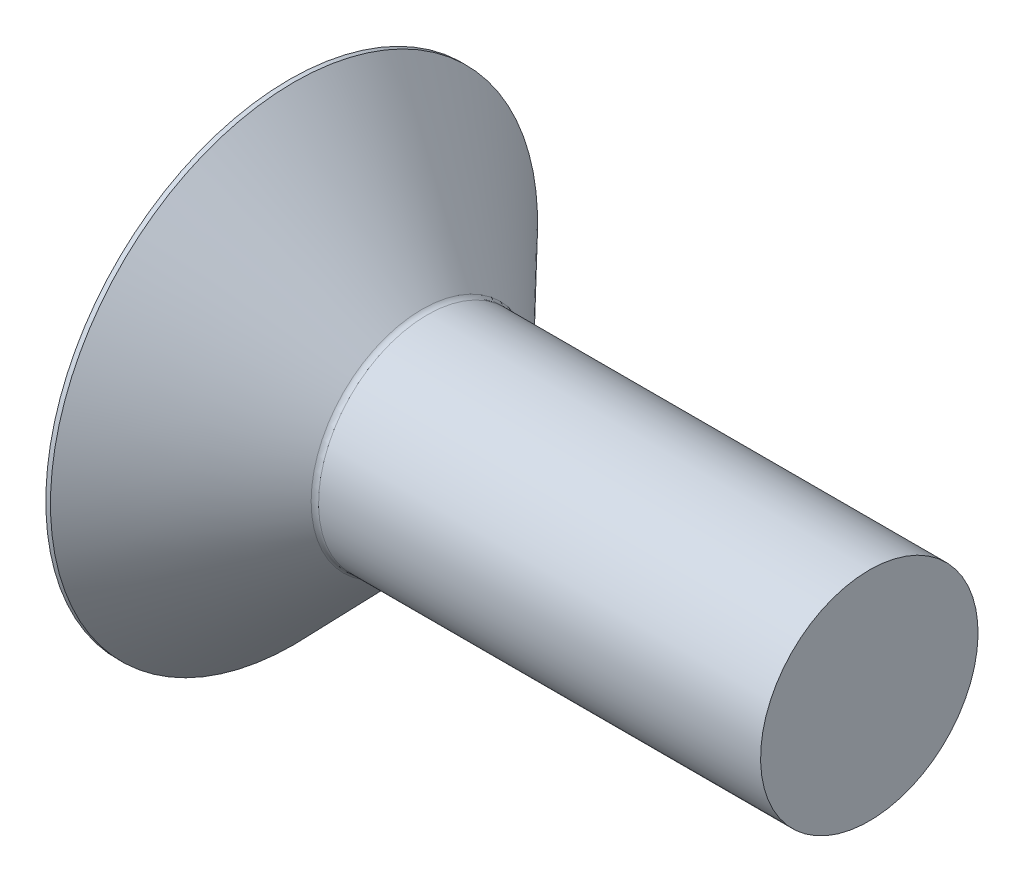
from build123d import *

# Parameters (mm, degrees)
CUT_EXTRUDE_1_DEPTH = 1.2
EXTRUDE_1_REACH     = 10.296


with BuildPart() as part:
    # 草图1 → 旋转1 (revolve)
    with BuildSketch(Plane.XY):
        with BuildLine():
            Line((0, 1.5), (-6.097552518, 1.5))
            ThreePointArc((-6.097552518, 1.5), (-6.136625631, 1.507949515), (-6.169486498, 1.530534163))
            Line((-6.169486498, 1.530534163), (-7.936181121, 3.36))
            Line((-7.936181121, 3.36), (-8, 3.36))
            Line((-8, 3.36), (-8, 0))
            Line((-8, 0), (0, 0))
            Line((0, 0), (0, 1.5))
        make_face()
    revolve(axis=Axis((0, 0, 0), (-1, 0, 0)))

    # 草图2 → 切除-拉伸1 (cut)
    with BuildSketch(Plane.ZY.offset(8)):
        Polygon((0, 1.154700538), (-1, 0.577350269), (-1, -0.577350269), (0, -1.154700538), (1, -0.577350269), (1, 0.577350269), align=None)
    extrude(amount=-CUT_EXTRUDE_1_DEPTH, mode=Mode.SUBTRACT)

    # 切除-拉伸2 cone 1 section (through the dimple's axis) → 切除-拉伸2 (revolve, cut)
    with BuildSketch(Plane(origin=(-6.8, 0, 0), x_dir=(0, 0, 1), z_dir=(0, 1, 0))):
        Polygon((0, 0), (1.154700538, 0), (0, 0.666666667), align=None)
    revolve(axis=Axis((-6.8, 0, 0), (1, 0, 0)), mode=Mode.SUBTRACT)

    # 凸台-拉伸1: up to this cone (the profile starts inside it)
    extrude_1_end = Plane(origin=(-6.8, 0, 0), z_dir=(-1, 0, 0)).offset(-0.666665667) * Cone(1.732e-06, 21.853921057, 12.617366205, align=(Align.CENTER, Align.CENTER, Align.MIN), mode=Mode.PRIVATE)
    # 草图5<3> → 凸台-拉伸1 (add, up to the surface)
    with BuildSketch(Plane.ZY.offset(6.8), mode=Mode.PRIVATE) as extrude_1_sk1:
        with BuildLine():
            ThreePointArc((1, -0.577350269), (1.154700538, 0), (1, 0.577350269))
            Line((1, 0.577350269), (1, -0.577350269))
        make_face()
    extrude_1_tool1 = extrude(extrude_1_sk1.sketch, amount=-EXTRUDE_1_REACH, mode=Mode.PRIVATE) & extrude_1_end
    add(extrude_1_tool1.solids().sort_by_distance((-6.8, 0, 1.06225))[0])
    # 草图5<3> → 凸台-拉伸1 (add, up to the surface)
    with BuildSketch(Plane.ZY.offset(6.8), mode=Mode.PRIVATE) as extrude_1_sk2:
        with BuildLine():
            Line((0, 1.154700538), (1, 0.577350269))
            ThreePointArc((1, 0.577350269), (0.577350269, 1), (0, 1.154700538))
        make_face()
    extrude_1_tool2 = extrude(extrude_1_sk2.sketch, amount=-EXTRUDE_1_REACH, mode=Mode.PRIVATE) & extrude_1_end
    add(extrude_1_tool2.solids().sort_by_distance((-6.8, 0.919935, 0.531125))[0])
    # 草图5<3> → 凸台-拉伸1 (add, up to the surface)
    with BuildSketch(Plane.ZY.offset(6.8), mode=Mode.PRIVATE) as extrude_1_sk3:
        with BuildLine():
            Line((-1, 0.577350269), (0, 1.154700538))
            ThreePointArc((0, 1.154700538), (-0.577350269, 1), (-1, 0.577350269))
        make_face()
    extrude_1_tool3 = extrude(extrude_1_sk3.sketch, amount=-EXTRUDE_1_REACH, mode=Mode.PRIVATE) & extrude_1_end
    add(extrude_1_tool3.solids().sort_by_distance((-6.8, 0.919935, -0.531125))[0])
    # 草图5<3> → 凸台-拉伸1 (add, up to the surface)
    with BuildSketch(Plane.ZY.offset(6.8), mode=Mode.PRIVATE) as extrude_1_sk4:
        with BuildLine():
            ThreePointArc((0, -1.154700538), (0.577350269, -1), (1, -0.577350269))
            Line((1, -0.577350269), (0, -1.154700538))
        make_face()
    extrude_1_tool4 = extrude(extrude_1_sk4.sketch, amount=-EXTRUDE_1_REACH, mode=Mode.PRIVATE) & extrude_1_end
    add(extrude_1_tool4.solids().sort_by_distance((-6.8, -0.919935, 0.531125))[0])
    # 草图5<3> → 凸台-拉伸1 (add, up to the surface)
    with BuildSketch(Plane.ZY.offset(6.8), mode=Mode.PRIVATE) as extrude_1_sk5:
        with BuildLine():
            Line((-1, -0.577350269), (-1, 0.577350269))
            ThreePointArc((-1, 0.577350269), (-1.154700538, 0), (-1, -0.577350269))
        make_face()
    extrude_1_tool5 = extrude(extrude_1_sk5.sketch, amount=-EXTRUDE_1_REACH, mode=Mode.PRIVATE) & extrude_1_end
    add(extrude_1_tool5.solids().sort_by_distance((-6.8, 0, -1.06225))[0])
    # 草图5<3> → 凸台-拉伸1 (add, up to the surface)
    with BuildSketch(Plane.ZY.offset(6.8), mode=Mode.PRIVATE) as extrude_1_sk6:
        with BuildLine():
            ThreePointArc((-1, -0.577350269), (-0.577350269, -1), (0, -1.154700538))
            Line((0, -1.154700538), (-1, -0.577350269))
        make_face()
    extrude_1_tool6 = extrude(extrude_1_sk6.sketch, amount=-EXTRUDE_1_REACH, mode=Mode.PRIVATE) & extrude_1_end
    add(extrude_1_tool6.solids().sort_by_distance((-6.8, -0.919935, -0.531125))[0])

    # 切除-拉伸3 cone 1 section (through the dimple's axis) → 切除-拉伸3 (revolve, cut)
    with BuildSketch(Plane(origin=(-8, 0, 0), x_dir=(0, 0, 1), z_dir=(0, 1, 0))):
        Polygon((0, 0), (1.154700538, 0), (0, 0.666666667), align=None)
    revolve(axis=Axis((-8, 0, 0), (1, 0, 0)), mode=Mode.SUBTRACT)


solid = part.part
